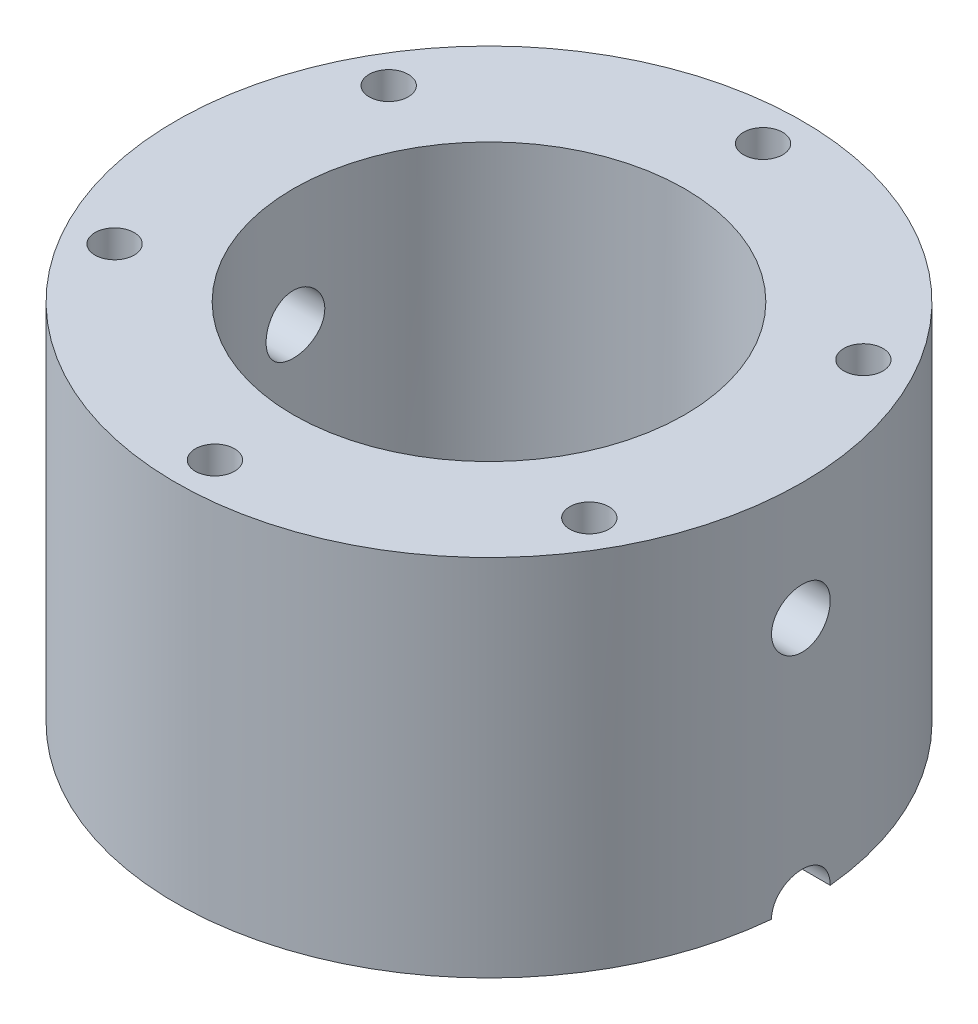
from build123d import *

# Parameters (mm, degrees)
SKETCH1_R                = 20.32
CYLINDER_DEPTH           = 26.162
SKETCH18_R               = 12.7
CUT_EXTRUDE10_DEPTH      = 23.368
SKETCH19_R               = 1.905
CUT_EXTRUDE12_REACH      = 40.862
SKETCH21_R               = 1.27
CIRPATTERN4_COUNT        = 6
CUT_EXTRUDE13_REACH      = 39.039
SKETCH22_R               = 8.001
CUT_EXTRUDE15_REACH      = 54.431
SKETCH25_R               = 1.905
CIRPATTERN6_COUNT        = 2
SKETCH26_R               = 1.905
CUT_EXTRUDE16_DEPTH      = 53.430547026
CUT_EXTRUDE17_DEPTH      = 39.862000183
CUT_EXTRUDE17_DEPTH_BACK = 39.862000183
SKETCH27_W               = 40.64
SKETCH27_H               = 2.54


with BuildPart() as part:
    # Sketch1 → Cylinder (new body)
    with BuildSketch(Plane(origin=(0, 0, 0), x_dir=(1, 0, 0), z_dir=(0, 1, 0))):
        Circle(SKETCH1_R)
    extrude(amount=CYLINDER_DEPTH)

    # Sketch18 → Cut-Extrude10 (cut)
    with BuildSketch(Plane(origin=(0, 26.162, 0), x_dir=(1, 0, 0), z_dir=(0, 1, 0))):
        Circle(SKETCH18_R)
    extrude(amount=-CUT_EXTRUDE10_DEPTH, mode=Mode.SUBTRACT)

    # Sketch19 → Cut-Revolve7 (revolve, cut)
    with BuildSketch(Plane.XY):
        with Locations((12.573, 0)):
            Circle(SKETCH19_R)
    revolve(axis=Axis((0, 13.335, 0), (0, -1, 0)), mode=Mode.SUBTRACT)

    # Sketch21 → Cut-Extrude12 (cut, up to next)
    with BuildSketch(Plane(origin=(0, 26.162, 0), x_dir=(1, 0, 0), z_dir=(0, 1, 0)), mode=Mode.PRIVATE) as cut_extrude12_sk1:
        with Locations((0, 17.78)):
            Circle(SKETCH21_R)
    cut_extrude12_tool1 = extrude(cut_extrude12_sk1.sketch, amount=-CUT_EXTRUDE12_REACH, mode=Mode.PRIVATE) & part.part
    cut_extrude12 = cut_extrude12_tool1.solids().sort_by_distance((0, 26.162, -17.78))[0]
    add(cut_extrude12, mode=Mode.SUBTRACT)

    # CirPattern4: Cut-Extrude12 ×6 about axis
    cirpattern4_axis = Axis((0, 13.335, 0), (0, -1, 0))
    for i in range(1, CIRPATTERN4_COUNT):
        add(cut_extrude12.rotate(cirpattern4_axis, i * 360 / CIRPATTERN4_COUNT), mode=Mode.SUBTRACT)

    # Sketch22 → Cut-Extrude13 (cut, up to next)
    with BuildSketch(Plane(origin=(0, 2.794, 0), x_dir=(1, 0, 0), z_dir=(0, 1, 0)), mode=Mode.PRIVATE) as cut_extrude13_sk1:
        Circle(SKETCH22_R)
    cut_extrude13_tool1 = extrude(cut_extrude13_sk1.sketch, amount=-CUT_EXTRUDE13_REACH, mode=Mode.PRIVATE) & part.part
    add(cut_extrude13_tool1.solids().sort_by_distance((0, 2.794, 0))[0], mode=Mode.SUBTRACT)

    # Sketch25 → Cut-Extrude15 (cut, up to next)
    with BuildSketch(Plane(origin=(20.32, 0, 0), x_dir=(0, 0, -1), z_dir=(1, 0, 0)), mode=Mode.PRIVATE) as cut_extrude15_sk1:
        Circle(SKETCH25_R)
    cut_extrude15_tool1 = extrude(cut_extrude15_sk1.sketch, amount=-CUT_EXTRUDE15_REACH, mode=Mode.PRIVATE) & part.part
    cut_extrude15 = cut_extrude15_tool1.solids().sort_by_distance((20.32, 0, 0))[0]
    add(cut_extrude15, mode=Mode.SUBTRACT)

    # CirPattern6: Cut-Extrude15 ×2 about axis
    cirpattern6_axis = Axis((0, 13.335, 0), (0, -1, 0))
    for i in range(1, CIRPATTERN6_COUNT):
        add(cut_extrude15.rotate(cirpattern6_axis, i * 360 / CIRPATTERN6_COUNT), mode=Mode.SUBTRACT)

    # Sketch26 → Cut-Extrude16 (cut, through all)
    with BuildSketch(Plane(origin=(20.32, 0, 0), x_dir=(0, 0, -1), z_dir=(1, 0, 0))):
        with Locations((0, 16.002)):
            Circle(SKETCH26_R)
    extrude(amount=-CUT_EXTRUDE16_DEPTH, mode=Mode.SUBTRACT)

    # Sketch27 → Cut-Extrude17 (cut, two sides: drawn at the far end of the back side and taken through both)
    with BuildSketch(Plane.XY.offset(-CUT_EXTRUDE17_DEPTH_BACK)):
        with Locations((0, 24.892)):
            Rectangle(SKETCH27_W, SKETCH27_H)
    extrude(amount=CUT_EXTRUDE17_DEPTH + CUT_EXTRUDE17_DEPTH_BACK, mode=Mode.SUBTRACT)


solid = part.part
